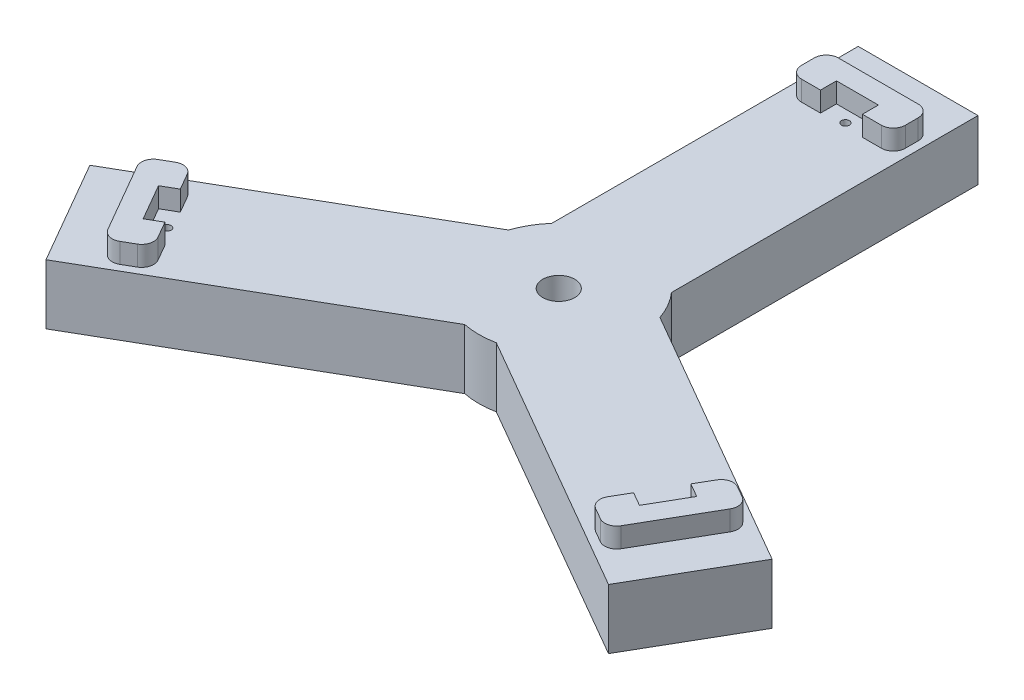
from build123d import *

# Parameters (mm, degrees)
SKETCH5_R                = 20
BOSS_EXTRUDE2_DEPTH      = 15
SKETCH6_W                = 30
SKETCH6_H                = 90
BOSS_EXTRUDE3_DEPTH      = 15
CIRPATTERN1_COUNT        = 3
BOSS_EXTRUDE4_DEPTH      = 5
FILLET1_R                = 3
SKETCH8_R                = 1
CUT_EXTRUDE1_DEPTH       = 126.001537171
SKETCH9_R                = 10
CUT_EXTRUDE2_DEPTH       = 10
CIRPATTERN4_COUNT        = 3
FILLET1_OF_CIRPATTERN4_R = 3
CIRPATTERN6_COUNT        = 3
SKETCH10_R               = 11
CUT_EXTRUDE3_DEPTH       = 4
CUT_EXTRUDE4_REACH       = 127.7
SKETCH11_R               = 4


with BuildPart() as part:
    # Sketch5 → Boss-Extrude2 (new body)
    with BuildSketch(Plane(origin=(0, 0, 0), x_dir=(1, 0, 0), z_dir=(0, 1, 0))):
        Circle(SKETCH5_R)
    extrude(amount=BOSS_EXTRUDE2_DEPTH)

    # Sketch6 → Boss-Extrude3 (add)
    with BuildSketch(Plane(origin=(0, 0, 0), x_dir=(1, 0, 0), z_dir=(0, 1, 0))):
        with Locations((0, 45)):
            Rectangle(SKETCH6_W, SKETCH6_H)
    boss_extrude3 = extrude(amount=BOSS_EXTRUDE3_DEPTH)

    # CirPattern1: Boss-Extrude3 ×3 about axis
    cirpattern1_axis = Axis((0, 15, 0), (0, -1, 0))
    for i in range(1, CIRPATTERN1_COUNT):
        add(boss_extrude3.rotate(cirpattern1_axis, i * 360 / CIRPATTERN1_COUNT))

    # Sketch7 → Boss-Extrude4 (add)
    with BuildSketch(Plane(origin=(0, 15, 0), x_dir=(1, 0, 0), z_dir=(0, 1, 0))):
        Polygon((-13, 80), (13, 80), (13, 70.8), (5.25, 70.8), (5.25, 74.8), (-5.25, 74.8), (-5.25, 70.8), (-13, 70.8), align=None)
    boss_extrude4 = extrude(amount=BOSS_EXTRUDE4_DEPTH)

    # Fillet1
    fillet1_edges = [part.edges().sort_by_distance(p)[0] for p in [
        (13, 17.5, -70.8),
        (13, 17.5, -80),
        (-13, 17.5, -70.8),
        (-13, 17.5, -80),
    ]]
    fillet(fillet1_edges, radius=FILLET1_R)

    # Sketch8 → Cut-Extrude1 (cut, through all)
    with BuildSketch(Plane(origin=(0, 15, 0), x_dir=(1, 0, 0), z_dir=(0, 1, 0))):
        with Locations((0, 71.8)):
            Circle(SKETCH8_R)
    cut_extrude1 = extrude(amount=-CUT_EXTRUDE1_DEPTH, mode=Mode.SUBTRACT)

    # Sketch9 → Cut-Extrude2 (cut)
    with BuildSketch(Plane.XZ):
        with Locations((0, -71.8)):
            Circle(SKETCH9_R)
    cut_extrude2 = extrude(amount=-CUT_EXTRUDE2_DEPTH, mode=Mode.SUBTRACT)

    # CirPattern4: Boss-Extrude4 ×3 about axis
    cirpattern4_axis = Axis((0, 15, 0), (0, -1, 0))
    for i in range(1, CIRPATTERN4_COUNT):
        add(boss_extrude4.rotate(cirpattern4_axis, i * 360 / CIRPATTERN4_COUNT))

    # Fillet1 of CirPattern4
    fillet1_of_cirpattern4_edges = [part.edges().sort_by_distance(p)[0] for p in [
        (54.814598588, 17.5, 46.658330249),
        (62.782032303, 17.5, 51.258330249),
        (67.814598588, 17.5, 24.141669751),
        (75.782032303, 17.5, 28.741669751),
        (-67.814598588, 17.5, 24.141669751),
        (-75.782032303, 17.5, 28.741669751),
        (-54.814598588, 17.5, 46.658330249),
        (-62.782032303, 17.5, 51.258330249),
    ]]
    fillet(fillet1_of_cirpattern4_edges, radius=FILLET1_OF_CIRPATTERN4_R)

    # CirPattern6: Cut-Extrude1, Cut-Extrude2 ×3 about axis
    cirpattern6_axis = Axis((0, 15, 0), (0, -1, 0))
    add([cut_extrude1.rotate(cirpattern6_axis, i * 360 / CIRPATTERN6_COUNT) for i in range(1, CIRPATTERN6_COUNT)], mode=Mode.SUBTRACT)
    add([cut_extrude2.rotate(cirpattern6_axis, i * 360 / CIRPATTERN6_COUNT) for i in range(1, CIRPATTERN6_COUNT)], mode=Mode.SUBTRACT)

    # Sketch10 → Cut-Extrude3 (cut)
    with BuildSketch(Plane.XZ):
        Circle(SKETCH10_R)
    extrude(amount=-CUT_EXTRUDE3_DEPTH, mode=Mode.SUBTRACT)

    # Sketch11 → Cut-Extrude4 (cut, up to next)
    with BuildSketch(Plane(origin=(0, 0, 0), x_dir=(1, 0, 0), z_dir=(0, 1, 0)), mode=Mode.PRIVATE) as cut_extrude4_sk1:
        Circle(SKETCH11_R)
    cut_extrude4_tool1 = extrude(cut_extrude4_sk1.sketch, amount=CUT_EXTRUDE4_REACH, mode=Mode.PRIVATE) & part.part
    add(cut_extrude4_tool1.solids().sort_by_distance((0, 0, 0))[0], mode=Mode.SUBTRACT)


solid = part.part
